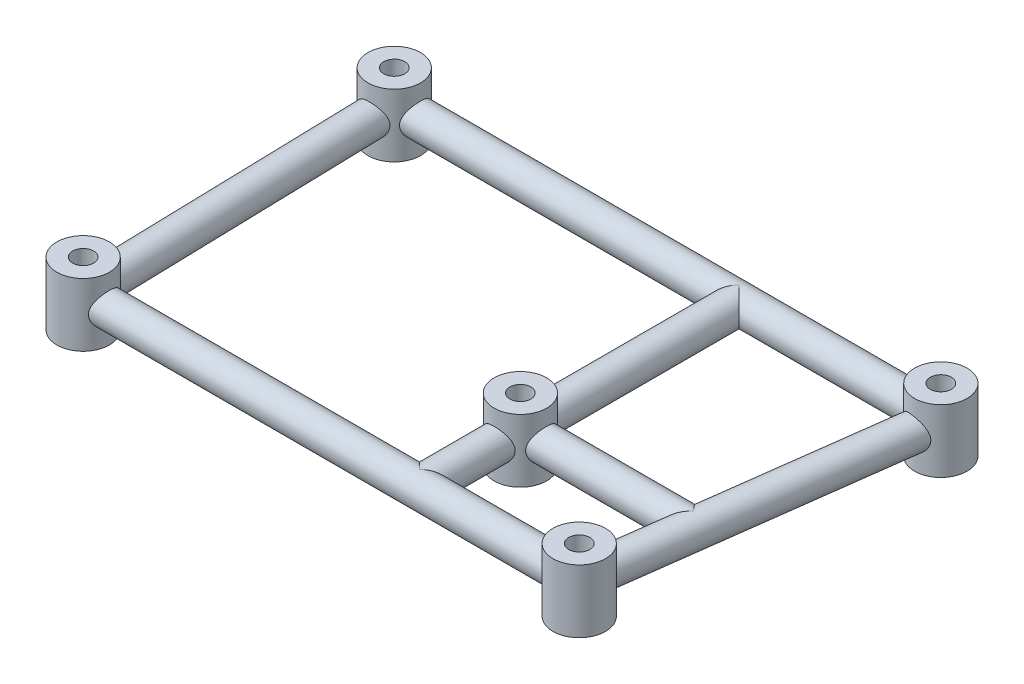
from build123d import *

# Parameters (mm, degrees)
SKETCH2_R             = 3.96875
BOSS_EXTRUDE1_DEPTH   = 9.525
BOSS_EXTRUDE1_2_DEPTH = 9.525
BOSS_EXTRUDE1_3_DEPTH = 9.525
BOSS_EXTRUDE1_4_DEPTH = 9.525
BOSS_EXTRUDE1_5_DEPTH = 9.525
SWEEP1_PROFILE_R      = 2.38125
SWEEP2_START          = -24.1300001
SWEEP2_OUTLINE_R      = 2.38125
SWEEP2_DEPTH          = 48.2600002
SWEEP3_PROFILE_R      = 2.38125
SKETCH109_R           = 1.5875
CUT_EXTRUDE1_DEPTH    = 105.777164882


# Read off the part's stored shape, not the designer's step: Sweep2
with BuildPart() as part:
    # Sketch2 → Boss-Extrude1 (new body)
    with BuildSketch(Plane(origin=(0, 0, 0), x_dir=(1, 0, 0), z_dir=(0, 1, 0))):
        with Locations(Location((13.97, 24.13, 0), (0, 0, 90))):
            Circle(SKETCH2_R)
    extrude(amount=BOSS_EXTRUDE1_DEPTH)



with BuildPart() as body_2:
    # Sketch2 → Boss-Extrude1 2 (new body)
    with BuildSketch(Plane(origin=(0, 0, 0), x_dir=(1, 0, 0), z_dir=(0, 1, 0))):
        with Locations(Location((96.52, 24.13, 0), (0, 0, 90))):
            Circle(SKETCH2_R)
    extrude(amount=BOSS_EXTRUDE1_2_DEPTH)


with BuildPart() as body_3:
    # Sketch2 → Boss-Extrude1 3 (new body)
    with BuildSketch(Plane(origin=(0, 0, 0), x_dir=(1, 0, 0), z_dir=(0, 1, 0))):
        with Locations(Location((90.17, -24.13, 0), (0, 0, 90))):
            Circle(SKETCH2_R)
    extrude(amount=BOSS_EXTRUDE1_3_DEPTH)


with BuildPart() as body_4:
    # Sketch2 → Boss-Extrude1 4 (new body)
    with BuildSketch(Plane(origin=(0, 0, 0), x_dir=(1, 0, 0), z_dir=(0, 1, 0))):
        with Locations(Location((15.24, -24.13, 0), (0, 0, 90))):
            Circle(SKETCH2_R)
    extrude(amount=BOSS_EXTRUDE1_4_DEPTH)


with BuildPart() as body_5:
    # Sketch2 → Boss-Extrude1 5 (new body)
    with BuildSketch(Plane(origin=(0, 0, 0), x_dir=(1, 0, 0), z_dir=(0, 1, 0))):
        with Locations(Location((66.04, -8.89, 0), (0, 0, 90))):
            Circle(SKETCH2_R)
    extrude(amount=BOSS_EXTRUDE1_5_DEPTH)


with BuildPart() as part_1:
    add(part.part)

    add(body_2.part)  # Sweep1 merges body 2

    add(body_3.part)  # Sweep1 merges body 3

    add(body_4.part)  # Sweep1 merges body 4
    # Sweep1: sweep along a path in Sketch5
    with BuildLine(Plane(origin=(0, 4.7625, 0), x_dir=(1, 0, 0), z_dir=(0, 1, 0))) as sweep1_path:
        Line((15.24, -24.13), (13.97, 24.13))
        Line((13.97, 24.13), (96.52, 24.13))
        Line((96.52, 24.13), (90.17, -24.13))
        Line((90.17, -24.13), (15.24, -24.13))
    # Sweep1 profile (on start of the path) → Sweep1 (sweep)
    with BuildSketch(Plane(origin=(15.24, 4.7625, 24.13), x_dir=(-0.9996539193528471, 0, 0.026306682088236274), z_dir=(-0.026306682088236274, 0, -0.9996539193528471))):
        Circle(SWEEP1_PROFILE_R)
    sweep(path=sweep1_path.line, transition=Transition.RIGHT)


    add(body_5.part)  # Sweep2 merges body 5
    # Sweep2 outline → Sweep2 (add)
    with BuildSketch(Plane.XY.offset(SWEEP2_START)):
        with Locations((66.04, 4.7625)):
            Circle(SWEEP2_OUTLINE_R)
    extrude(amount=SWEEP2_DEPTH)

    # Sweep3: sweep along a path in Sketch66
    with BuildLine(Plane(origin=(0, 4.7625, 0), x_dir=(1, 0, 0), z_dir=(0, 1, 0))) as sweep3_path:
        Line((66.04, -8.89), (92.175263158, -8.89))
    # Sweep3 profile (on start of the path) → Sweep3 (sweep)
    with BuildSketch(Plane(origin=(66.04, 4.7625, 8.89), x_dir=(0, 0, 1), z_dir=(1, 0, 0))):
        Circle(SWEEP3_PROFILE_R)
    sweep(path=sweep3_path.line)

    # Sketch109 → Cut-Extrude1 (cut, through all)
    with BuildSketch(Plane(origin=(0, 0, 0), x_dir=(1, 0, 0), z_dir=(0, 1, 0))):
        with Locations(Location((90.17, -24.13, 0), (0, 0, 90))):
            Circle(SKETCH109_R)
        with Locations(Location((96.52, 24.13, 0), (0, 0, 90))):
            Circle(SKETCH109_R)
        with Locations(Location((13.97, 24.13, 0), (0, 0, 90))):
            Circle(SKETCH109_R)
        with Locations(Location((15.24, -24.13, 0), (0, 0, 90))):
            Circle(SKETCH109_R)
        with Locations(Location((66.04, -8.89, 0), (0, 0, 90))):
            Circle(SKETCH109_R)
    extrude(amount=CUT_EXTRUDE1_DEPTH, mode=Mode.SUBTRACT)


solid = part_1.part
